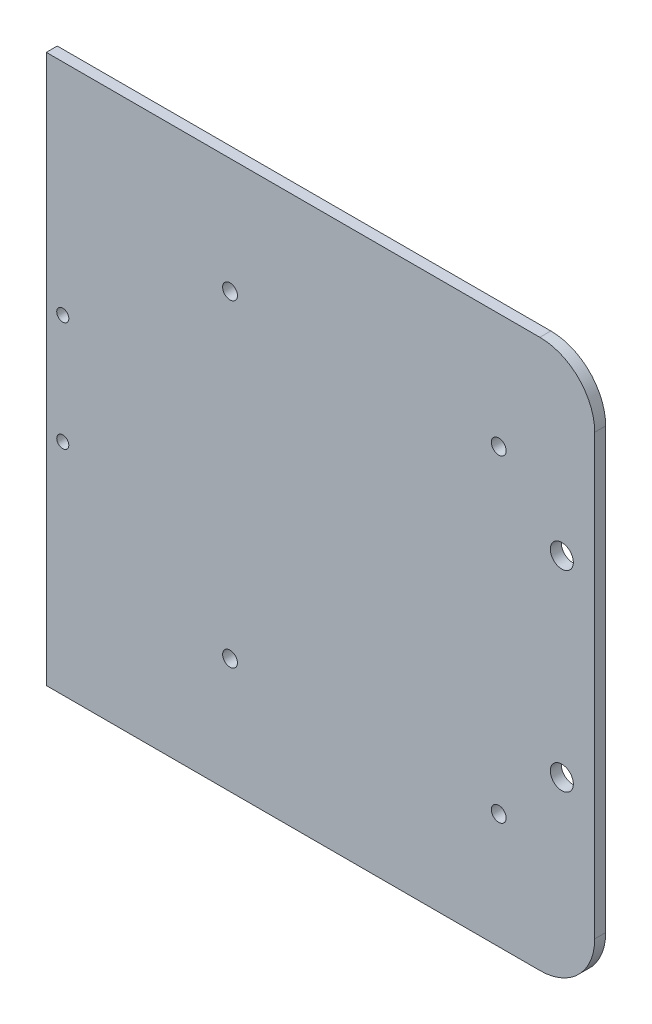
from build123d import *

# Parameters (mm, degrees)
SKETCH_1_R          = 1.1
EXTRUDE_1_DEPTH     = 2
SKETCH_3_R          = 1.35
CUT_EXTRUDE_1_DEPTH = 71.738956735
SKETCH_7_R          = 2.1
CUT_EXTRUDE_5_DEPTH = 10


with BuildPart() as part:
    # 草图1 → 凸台-拉伸1 (new body)
    with BuildSketch(Plane.XY):
        with BuildLine():
            Line((-50, 50), (40, 50))
            ThreePointArc((40, 50), (47.071067812, 47.071067812), (50, 40))
            Line((50, 40), (50, -40))
            ThreePointArc((50, -40), (47.071067812, -47.071067812), (40, -50))
            Line((40, -50), (-50, -50))
            Line((-50, -50), (-50, 50))
        make_face()
        with Locations((-47, 10)):
            Circle(SKETCH_1_R, mode=Mode.SUBTRACT)
        with Locations((-47, -10)):
            Circle(SKETCH_1_R, mode=Mode.SUBTRACT)
    extrude(amount=EXTRUDE_1_DEPTH)

    # 草图3 → 切除-拉伸1 (cut, through all)
    with BuildSketch(Plane.XY.offset(2)):
        with Locations((-16.5, -29)):
            Circle(SKETCH_3_R)
        with Locations((-16.5, 29)):
            Circle(SKETCH_3_R)
        with Locations((32.5, 29)):
            Circle(SKETCH_3_R)
        with Locations((32.5, -29)):
            Circle(SKETCH_3_R)
    extrude(amount=-CUT_EXTRUDE_1_DEPTH, mode=Mode.SUBTRACT)

    # 草图7 → 切除-拉伸5 (cut)
    with BuildSketch(Plane.XY.offset(2)):
        with Locations((44, 17.5)):
            Circle(SKETCH_7_R)
        with Locations((44, -17.5)):
            Circle(SKETCH_7_R)
    extrude(amount=-CUT_EXTRUDE_5_DEPTH, mode=Mode.SUBTRACT)


solid = part.part
